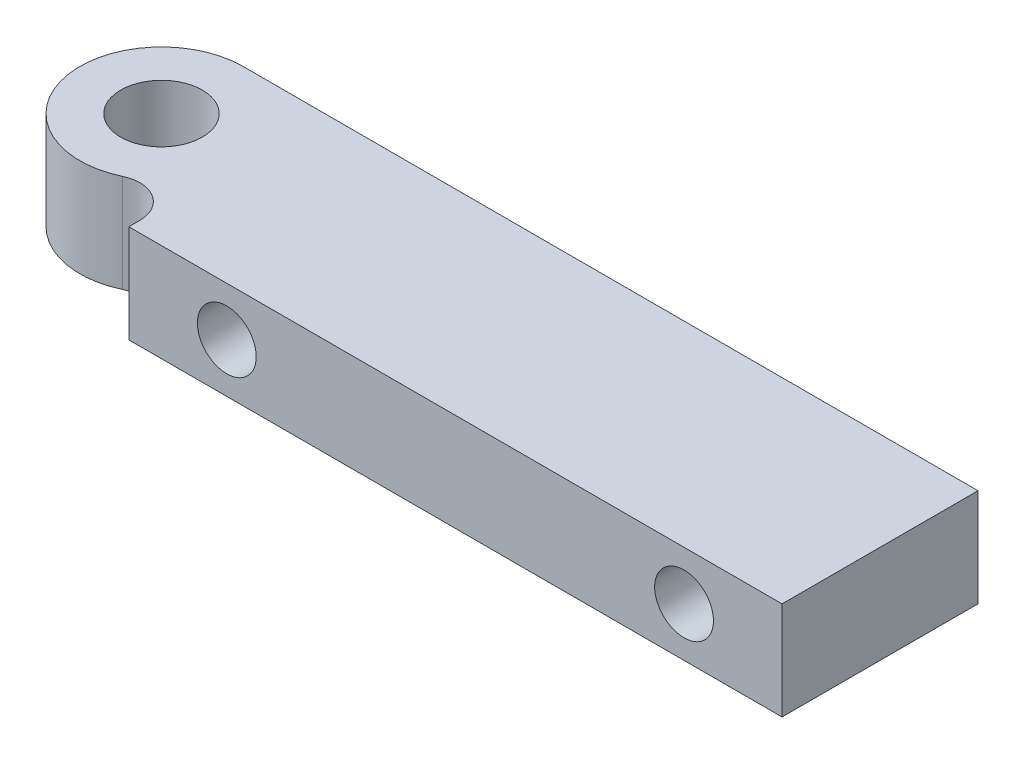
from build123d import *

# Parameters (mm, degrees)
SKETCH1_R           = 3.175
BOSS_EXTRUDE1_DEPTH = 3.8099999999999996
FILLET1_R           = 2.54
SKETCH2_R           = 2.285999999998936
SKETCH2_R_2         = 2.285999999998943
CUT_EXTRUDE1_DEPTH  = 5.08


with BuildPart() as part:
    # Sketch1 → Boss-Extrude1 (new, symmetric)
    with BuildSketch(Plane(origin=(0, 0, 0), x_dir=(1, 0, 0), z_dir=(0, 1, 0))):
        with BuildLine():
            Line((0, 6.35), (12.366459894249573, 6.35))
            Line((12.366459894249573, 6.35), (57.15, 6.35))
            Line((57.15, 6.35), (57.15, -8.889999999999999))
            Line((57.15, -8.889999999999999), (6.350000000000001, -8.889999999999999))
            Line((6.350000000000001, -8.889999999999999), (6.3500000000000005, 8.7e-16))
            ThreePointArc((6.3500000000000005, 8.7e-16), (-4.490128060534578, -4.490128060534576), (0, 6.35))
        make_face()
        Circle(SKETCH1_R, mode=Mode.SUBTRACT)
    extrude(amount=BOSS_EXTRUDE1_DEPTH, both=True)

    # Fillet1
    fillet1_edges = [part.edges().sort_by_distance(p)[0] for p in [
        (6.350000000000001, 0, -8.7e-16),
    ]]
    fillet(fillet1_edges, radius=FILLET1_R)

    # Sketch2 → Cut-Extrude1 (cut)
    with BuildSketch(Plane.XY.offset(8.889999999999999)):
        with Locations((49.53000000000124, 1.3e-15)):
            Circle(SKETCH2_R)
        with Locations((13.970000000001203, 1.3e-15)):
            Circle(SKETCH2_R_2)
    extrude(amount=-CUT_EXTRUDE1_DEPTH, mode=Mode.SUBTRACT)


solid = part.part
